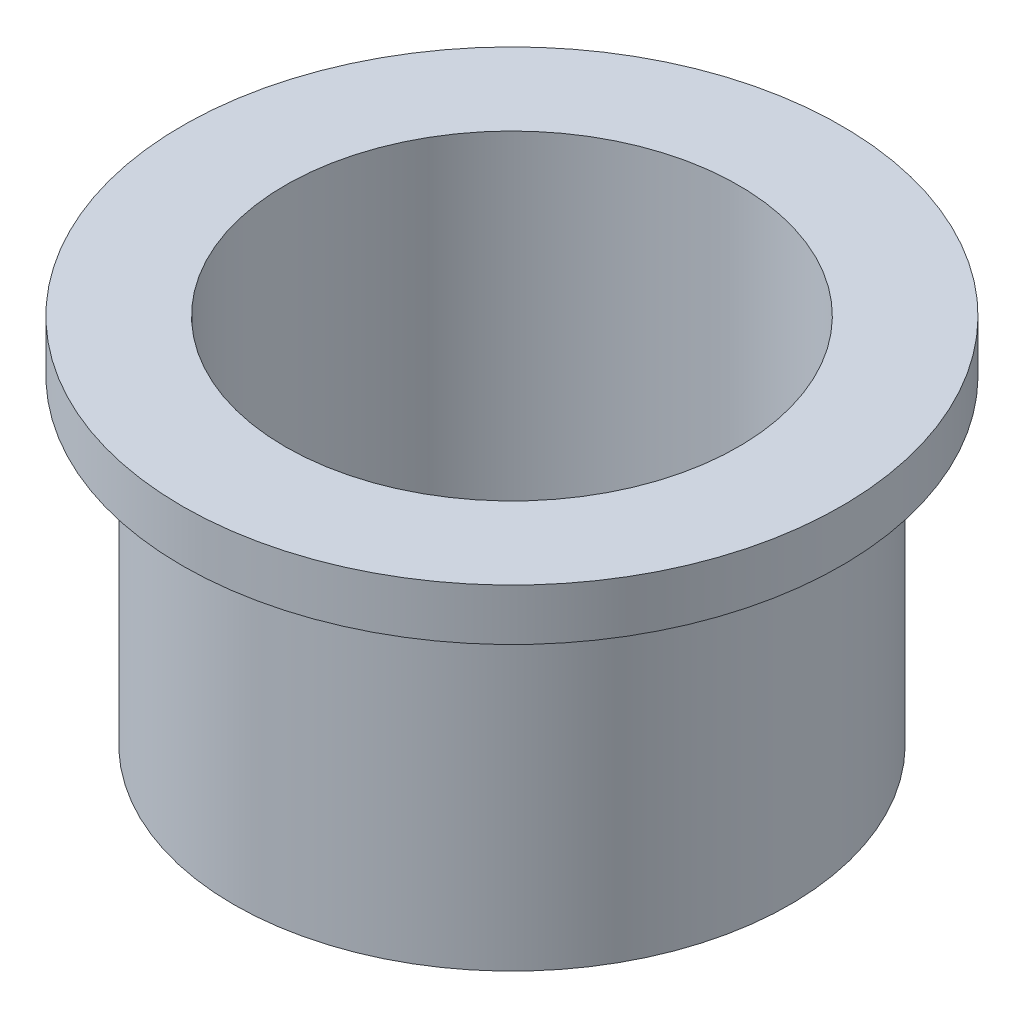
from build123d import *

# Parameters (mm, degrees)
SKETCH1_R           = 13.5
SKETCH1_R_2         = 11
BOSS_EXTRUDE1_DEPTH = 18
BOSS_EXTRUDE2_START = -2.5
SKETCH2_R           = 16
SKETCH2_R_2         = 13.5
BOSS_EXTRUDE2_DEPTH = 2.5


with BuildPart() as part:
    # Sketch1 → Boss-Extrude1 (new body)
    with BuildSketch(Plane(origin=(0, 0, 0), x_dir=(1, 0, 0), z_dir=(0, 1, 0))):
        Circle(SKETCH1_R)
        Circle(SKETCH1_R_2, mode=Mode.SUBTRACT)
    extrude(amount=BOSS_EXTRUDE1_DEPTH)

    # Sketch2 → Boss-Extrude2 (add)
    with BuildSketch(Plane(origin=(0, 18, 0), x_dir=(1, 0, 0), z_dir=(0, 1, 0)).offset(BOSS_EXTRUDE2_START)):
        Circle(SKETCH2_R)
        Circle(SKETCH2_R_2, mode=Mode.SUBTRACT)
    extrude(amount=BOSS_EXTRUDE2_DEPTH)


solid = part.part
